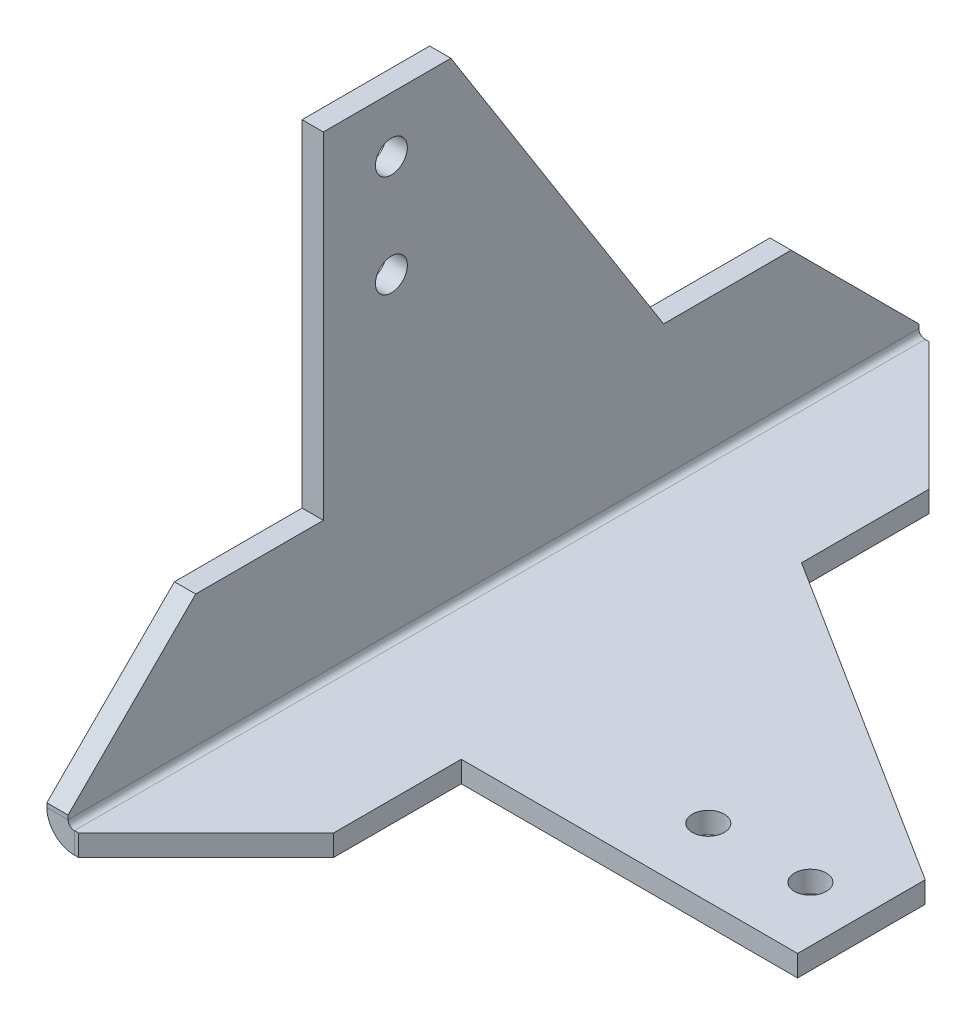
from build123d import *

# Parameters (mm, degrees)
SKETCH1_W                    = 58.25
SKETCH1_H                    = 100
BASE_FLANGE1_DEPTH           = 2.5
EDGE_FLANGE1_STRIP_W         = 11.4732
EDGE_FLANGE1_STRIP_H         = 2.5
EDGE_FLANGE1_STRIP_CUT_DEPTH = 100
EDGE_FLANGE1_DEPTH           = 100
CUT_EXTRUDE1_START           = -30
CUT_EXTRUDE1_OUTLINE_W       = 2.5
CUT_EXTRUDE1_OUTLINE_H       = 39.536796564
CUT_EXTRUDE1_OUTLINE_W_2     = 39.536796564
CUT_EXTRUDE1_OUTLINE_H_2     = 2.5
CUT_EXTRUDE1_DEPTH           = 30
CUT_EXTRUDE2_REACH           = 98.365
SKETCH21_R                   = 1.875
CIRPATTERN1_COUNT            = 2
CIRPATTERN1_ANGLE            = 90
CUT_EXTRUDE3_REACH           = 98.365
CIRPATTERN2_COUNT            = 2
CIRPATTERN2_ANGLE            = 90
CHAMFER1_SIZE                = 15


# Read off the part's stored shape, not the designer's step: Cut-Extrude1
# Sheet-metal steps are written as plain solids
with BuildPart() as part:
    # Sketch1 → Base-Flange1 (new body)
    with BuildSketch(Plane(origin=(0, 0, 0), x_dir=(1, 0, 0), z_dir=(0, 1, 0))):
        with Locations((29.125, 0)):
            Rectangle(SKETCH1_W, SKETCH1_H)
    extrude(amount=BASE_FLANGE1_DEPTH)

    # Edge-Flange1 strip (across the edge) → Edge-Flange1 strip cut (cut)
    with BuildSketch(Plane(origin=(0, 2.5, -50), x_dir=(1, 0, 0), z_dir=(0, 0, 1))):
        with Locations((-2.5, -1.25)):
            Rectangle(EDGE_FLANGE1_STRIP_W, EDGE_FLANGE1_STRIP_H)
    extrude(amount=EDGE_FLANGE1_STRIP_CUT_DEPTH, mode=Mode.SUBTRACT)

    # Edge-Flange1 section (across the edge) → Edge-Flange1 (add)
    with BuildSketch(Plane(origin=(0, 2.5, -50), x_dir=(1, 0, 0), z_dir=(0, 0, 1))):
        with BuildLine():
            Line((0, 0.7366), (0, 55.75))
            Line((0, 55.75), (2.5, 55.75))
            Line((2.5, 55.75), (2.5, 0.7366))
            ThreePointArc((2.5, 0.7366), (2.715745145, 0.215745145), (3.2366, 0))
            Line((3.2366, 0), (3.2366, -2.5))
            ThreePointArc((3.2366, -2.5), (0.947978192, -1.552021808), (0, 0.7366))
        make_face()
    extrude(amount=EDGE_FLANGE1_DEPTH)

    # Cut-Extrude1 outline → Cut-Extrude1 (cut)
    with BuildSketch(Plane.XY.offset(50).offset(CUT_EXTRUDE1_START)):
        with Locations((1.25, 38.481601718)):
            Rectangle(CUT_EXTRUDE1_OUTLINE_W, CUT_EXTRUDE1_OUTLINE_H)
        with Locations((38.481601718, 1.25)):
            Rectangle(CUT_EXTRUDE1_OUTLINE_W_2, CUT_EXTRUDE1_OUTLINE_H_2)
    cut_extrude1 = extrude(amount=CUT_EXTRUDE1_DEPTH, mode=Mode.SUBTRACT)

    # Sketch21 → Cut-Extrude2 (cut, up to next)
    with BuildSketch(Plane.XZ, mode=Mode.PRIVATE) as cut_extrude2_sk1:
        with Locations(Location((51.75, 12, 0), (0, 0, 270))):
            Circle(SKETCH21_R)
    cut_extrude2_tool1 = extrude(cut_extrude2_sk1.sketch, amount=-CUT_EXTRUDE2_REACH, mode=Mode.PRIVATE) & part.part
    # Sketch21 → Cut-Extrude2 (cut, up to next)
    with BuildSketch(Plane.XZ, mode=Mode.PRIVATE) as cut_extrude2_sk2:
        with Locations(Location((39.75, 12, 0), (0, 0, 270))):
            Circle(SKETCH21_R)
    cut_extrude2_tool2 = extrude(cut_extrude2_sk2.sketch, amount=-CUT_EXTRUDE2_REACH, mode=Mode.PRIVATE) & part.part
    cut_extrude2_1 = cut_extrude2_tool1.solids().sort_by_distance((51.75, 0, 12))[0]
    add(cut_extrude2_1, mode=Mode.SUBTRACT)
    cut_extrude2_2 = cut_extrude2_tool2.solids().sort_by_distance((39.75, 0, 12))[0]
    add(cut_extrude2_2, mode=Mode.SUBTRACT)
    cut_extrude2 = cut_extrude2_1 + cut_extrude2_2  # Cut-Extrude2 as one shape, for the pattern or mirror that repeats it

    # CirPattern1: Cut-Extrude2; each copy of Cut-Extrude2 runs up to whatever stops it at its own place
    cirpattern1_before = part.part  # the part as the pattern finds it: every copy runs up to it
    cirpattern1_cut_extrude2_long1 = extrude(cut_extrude2_sk1.sketch, amount=-CUT_EXTRUDE2_REACH, mode=Mode.PRIVATE)
    cirpattern1_cut_extrude2_long2 = extrude(cut_extrude2_sk2.sketch, amount=-CUT_EXTRUDE2_REACH, mode=Mode.PRIVATE)
    cirpattern1_cut_extrude2_tool1_1 = cirpattern1_cut_extrude2_long1.rotate(Axis((3.2366, 3.2366, 0), (0, 0, 1)), 1 * CIRPATTERN1_ANGLE / (CIRPATTERN1_COUNT - 1)) & cirpattern1_before
    add(cirpattern1_cut_extrude2_tool1_1.solids().sort_by_distance((6.4732, 51.75, 12))[0], mode=Mode.SUBTRACT)
    cirpattern1_cut_extrude2_tool2_1 = cirpattern1_cut_extrude2_long2.rotate(Axis((3.2366, 3.2366, 0), (0, 0, 1)), 1 * CIRPATTERN1_ANGLE / (CIRPATTERN1_COUNT - 1)) & cirpattern1_before
    add(cirpattern1_cut_extrude2_tool2_1.solids().sort_by_distance((6.4732, 39.75, 12))[0], mode=Mode.SUBTRACT)

    # Mirror1: Cut-Extrude1 across plane
    add(cut_extrude1.mirror(Plane.XY), mode=Mode.SUBTRACT)

    # Sketch22 → Cut-Extrude3 (cut, up to next)
    with BuildSketch(Plane.ZY, mode=Mode.PRIVATE) as cut_extrude3_sk1:
        Polygon((-20, 18.713203436), (-20, 58.25), (5, 58.25), align=None)
    cut_extrude3_tool1 = extrude(cut_extrude3_sk1.sketch, amount=-CUT_EXTRUDE3_REACH, mode=Mode.PRIVATE) & part.part
    cut_extrude3 = cut_extrude3_tool1.solids().sort_by_distance((0, 45.071068, -11.666667))[0]
    add(cut_extrude3, mode=Mode.SUBTRACT)

    # CirPattern2: Cut-Extrude3; each copy of Cut-Extrude3 runs up to whatever stops it at its own place
    cirpattern2_before = part.part  # the part as the pattern finds it: every copy runs up to it
    cirpattern2_cut_extrude3_long = extrude(cut_extrude3_sk1.sketch, amount=-CUT_EXTRUDE3_REACH, mode=Mode.PRIVATE)
    cirpattern2_cut_extrude3_tool1 = cirpattern2_cut_extrude3_long.rotate(Axis((3.2366, 3.2366, 0), (0, 0, -1)), 1 * CIRPATTERN2_ANGLE / (CIRPATTERN2_COUNT - 1)) & cirpattern2_before
    add(cirpattern2_cut_extrude3_tool1.solids().sort_by_distance((45.071068, 6.4732, -11.666667))[0], mode=Mode.SUBTRACT)

    # Chamfer1
    chamfer1_edges = [part.edges().sort_by_distance(p)[0] for p in [
        (1.25, 18.713203436, -50),
        (18.713203436, 1.25, -50),
        (1.25, 18.713203436, 50),
        (18.713203436, 1.25, 50),
    ]]
    chamfer(chamfer1_edges, length=CHAMFER1_SIZE)


solid = part.part
